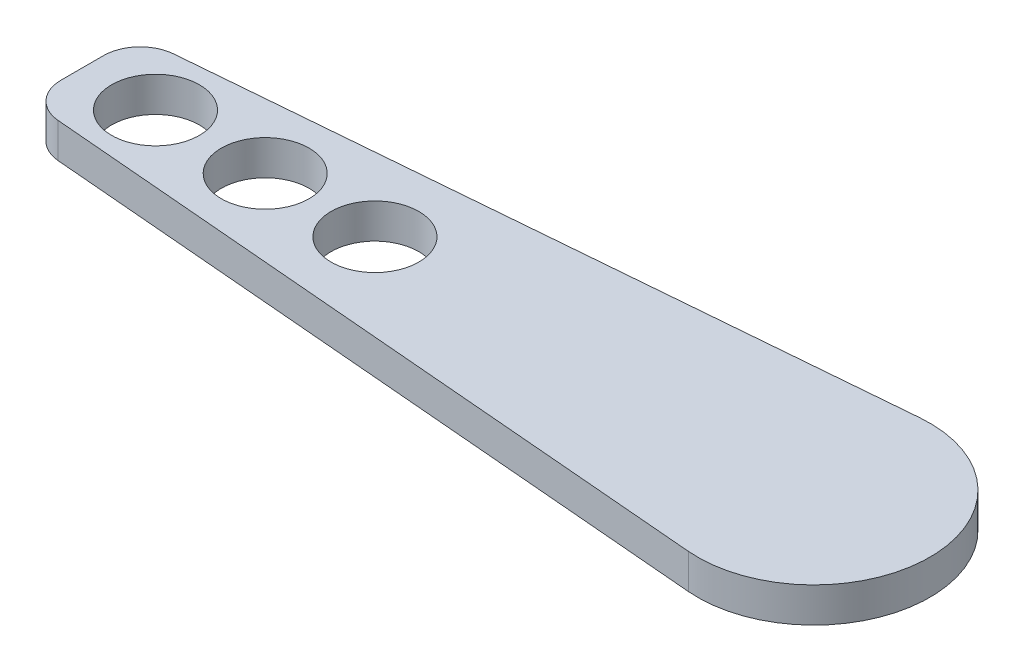
from build123d import *

# Parameters (mm, degrees)
SKETCH2_R           = 6
BOSS_EXTRUDE1_DEPTH = 4.7625
FILLET1_R           = 5


with BuildPart() as part:
    # Sketch2 → Boss-Extrude1 (new body)
    with BuildSketch(Plane(origin=(0, 0, 0), x_dir=(1, 0, 0), z_dir=(0, 1, 0))):
        with BuildLine():
            Line((-100, -7.5), (-1.333740348, -15.818873591))
            ThreePointArc((-1.333740348, -15.818873591), (15.875, 1.13e-07), (-1.333740574, 15.818873572))
            Line((-1.333740574, 15.818873572), (-100, 7.5))
            Line((-100, 7.5), (-100, -7.5))
        make_face()
        with Locations((-90, 0)):
            Circle(SKETCH2_R, mode=Mode.SUBTRACT)
        with Locations((-75, 0)):
            Circle(SKETCH2_R, mode=Mode.SUBTRACT)
        with Locations((-60, 0)):
            Circle(SKETCH2_R, mode=Mode.SUBTRACT)
    extrude(amount=BOSS_EXTRUDE1_DEPTH)

    # Fillet1
    fillet1_edges = [part.edges().sort_by_distance(p)[0] for p in [
        (-100, 2.38125, -7.5),
        (-100, 2.38125, 7.5),
    ]]
    fillet(fillet1_edges, radius=FILLET1_R)


solid = part.part
